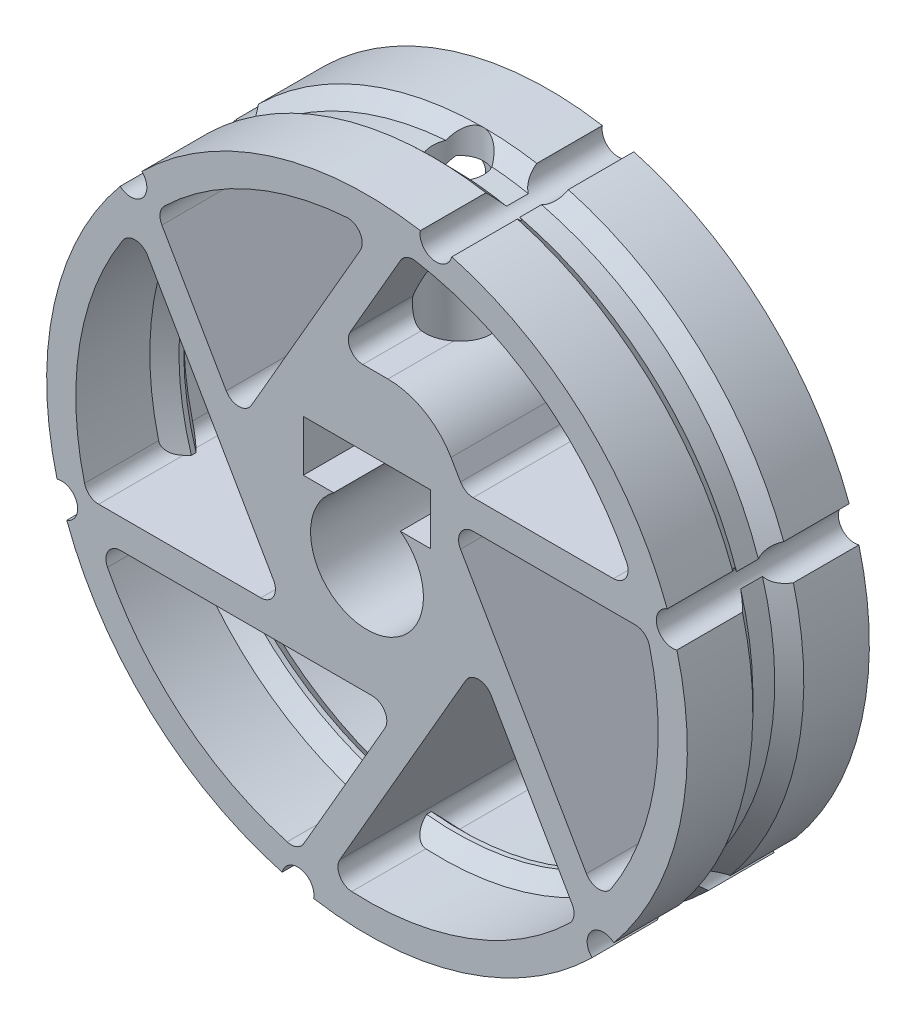
from build123d import *

# Parameters (mm, degrees)
SKETCH1_R               = 17.6
BOSS_EXTRUDE1_DEPTH     = 10
FILLET1_R               = 0.8
FILLET2_R               = 0.8
FILLET3_R               = 0.8
FILLET4_R               = 4
CUT_EXTRUDE1_REACH      = 32.564
CUT_EXTRUDE1_END_RADIUS = 16
SKETCH2_R               = 1.8
SKETCH6_R               = 1.4
CUT_EXTRUDE3_DEPTH      = 31.564194771
SKETCH3_R               = 0.886338762
CUT_EXTRUDE2_DEPTH      = 27.823870149


with BuildPart() as part:
    # Sketch1 → Boss-Extrude1 (new body)
    with BuildSketch(Plane.XY):
        Circle(SKETCH1_R)
        with BuildLine():
            Line((1.833030278, 2.5), (3.5, 2.5))
            Line((3.5, 2.5), (3.5, 5.3))
            Line((3.5, 5.3), (-3.5, 5.3))
            Line((-3.5, 5.3), (-3.5, 2.5))
            Line((-3.5, 2.5), (-1.833030278, 2.5))
            ThreePointArc((-1.833030278, 2.5), (0, -3.1), (1.833030278, 2.5))
        make_face(mode=Mode.SUBTRACT)
        with BuildLine():
            Line((-7.043673284, 0), (-12.678530784, 9.759859484))
            ThreePointArc((-12.678530784, 9.759859484), (-15.725575717, 2.95063864), (-15.354152533, -4.5))
            Line((-15.354152533, -4.5), (-4.445597073, -4.5))
            Line((-4.445597073, -4.5), (-7.043673284, 0))
        make_face(mode=Mode.SUBTRACT)
        with BuildLine():
            Line((-3.521836642, -6.1), (-14.791551643, -6.1))
            ThreePointArc((-14.791551643, -6.1), (-10.418115878, -12.14342874), (-3.779961949, -15.547086147))
            Line((-3.779961949, -15.547086147), (1.674315781, -6.1))
            Line((1.674315781, -6.1), (-3.521836642, -6.1))
        make_face(mode=Mode.SUBTRACT)
        with BuildLine():
            Line((3.521836642, -6.1), (-2.113020858, -15.859859484))
            ThreePointArc((-2.113020858, -15.859859484), (5.307459839, -15.09406738), (11.574190583, -11.047086147))
            Line((11.574190583, -11.047086147), (6.119912853, -1.6))
            Line((6.119912853, -1.6), (3.521836642, -6.1))
        make_face(mode=Mode.SUBTRACT)
        with BuildLine():
            Line((7.043673284, 0), (12.678530784, -9.759859484))
            ThreePointArc((12.678530784, -9.759859484), (15.725575717, -2.95063864), (15.354152533, 4.5))
            Line((15.354152533, 4.5), (4.445597073, 4.5))
            Line((4.445597073, 4.5), (7.043673284, 0))
        make_face(mode=Mode.SUBTRACT)
        with BuildLine():
            Line((-11.574190583, 11.047086147), (-7.043673284, 3.2))
            Line((-7.043673284, 3.2), (-3.46132901, 9.404802293))
            Line((-3.46132901, 9.404802293), (0.344271501, 15.996295732))
            ThreePointArc((0.344271501, 15.996295732), (-6.136076884, 14.776622093), (-11.574190583, 11.047086147))
        make_face(mode=Mode.SUBTRACT)
        with BuildLine():
            Line((3.46132901, 9.404802293), (5.369357503, 6.1))
            Line((5.369357503, 6.1), (14.791551643, 6.1))
            ThreePointArc((14.791551643, 6.1), (9.759859484, 12.678530784), (2.113020858, 15.859859484))
            Line((2.113020858, 15.859859484), (-1.613808149, 9.404802293))
            Line((-1.613808149, 9.404802293), (3.46132901, 9.404802293))
        make_face(mode=Mode.SUBTRACT)
    extrude(amount=BOSS_EXTRUDE1_DEPTH)

    # Fillet1
    fillet1_edges = [part.edges().sort_by_distance(p)[0] for p in [
        (4.445597073, 4.5, 5),
        (6.119912853, -1.6, 5),
        (1.674315781, -6.1, 5),
        (-4.445597073, -4.5, 5),
        (-7.043673284, 3.2, 5),
        (-1.613808149, 9.404802293, 5),
        (5.369357503, 6.1, 5),
    ]]
    fillet(fillet1_edges, radius=FILLET1_R)

    # Fillet2
    fillet2_edges = [part.edges().sort_by_distance(p)[0] for p in [
        (12.678530784, -9.759859484, 5),
        (14.791551643, 6.1, 5),
        (-12.678530784, 9.759859484, 5),
        (-14.791551643, -6.1, 5),
        (-2.113020858, -15.859859484, 5),
        (0.344271501, 15.996295732, 5),
    ]]
    fillet(fillet2_edges, radius=FILLET2_R)

    # Fillet3
    fillet3_edges = [part.edges().sort_by_distance(p)[0] for p in [
        (-15.354152533, -4.5, 5),
        (-11.574190583, 11.047086147, 5),
        (15.354152533, 4.5, 5),
        (11.574190583, -11.047086147, 5),
        (-3.779961949, -15.547086147, 5),
        (2.113020858, 15.859859484, 5),
    ]]
    fillet(fillet3_edges, radius=FILLET3_R)

    # Fillet4
    fillet4_edges = [part.edges().sort_by_distance(p)[0] for p in [
        (3.46132901, 9.404802293, 5),
    ]]
    fillet(fillet4_edges, radius=FILLET4_R)

    # Cut-Extrude1: up to this cylinder (the profile starts inside it)
    cut_extrude1_end = Plane(origin=(0, 0, 5), z_dir=(0, 0, -1)) * Cylinder(CUT_EXTRUDE1_END_RADIUS, 98.128, mode=Mode.PRIVATE)
    # Sketch2 → Cut-Extrude1 (cut, up to the surface)
    with BuildSketch(Plane.XZ.offset(-5.3), mode=Mode.PRIVATE) as cut_extrude1_sk1:
        with Locations((0, 5)):
            Circle(SKETCH2_R)
    cut_extrude1_tool1 = extrude(cut_extrude1_sk1.sketch, amount=-CUT_EXTRUDE1_REACH, mode=Mode.PRIVATE) & cut_extrude1_end
    add(cut_extrude1_tool1.solids().sort_by_distance((0, 5.3, 5))[0], mode=Mode.SUBTRACT)

    # Sketch7 → Revolve1 (revolve)
    with BuildSketch(Plane(origin=(0, 0, 0), x_dir=(1, 0, 0), z_dir=(0, 1, 0))):
        Polygon((-17.6, -2.46862915), (-17.6, -7.53137085), (-15.2, -5.13137085), (-15.2, -4.86862915), align=None)
    revolve(axis=Axis((0, 0, 10), (0, 0, -1)))

    # Sketch6 → Cut-Extrude3 (cut, through all)
    with BuildSketch(Plane.XZ.offset(-5.3)):
        with Locations((0, 5)):
            Circle(SKETCH6_R)
    extrude(amount=-CUT_EXTRUDE3_DEPTH, mode=Mode.SUBTRACT)

    # Sketch3 → Cut-Extrude2 (cut, through all)
    with BuildSketch(Plane.XY.offset(10)):
        with Locations((-3.80157893, -17.184527856)):
            Circle(SKETCH3_R)
        with Locations((-16.783027141, -5.3)):
            Circle(SKETCH3_R)
        with Locations((-12.98144821, 11.884527856)):
            Circle(SKETCH3_R)
        with Locations((3.80157893, 17.184527856)):
            Circle(SKETCH3_R)
        with Locations((16.783027141, 5.3)):
            Circle(SKETCH3_R)
        with Locations((12.98144821, -11.884527856)):
            Circle(SKETCH3_R)
    extrude(amount=-CUT_EXTRUDE2_DEPTH, mode=Mode.SUBTRACT)

    # Sketch5 → Cut-Revolve2 (revolve, cut)
    with BuildSketch(Plane(origin=(0, 0, 0), x_dir=(1, 0, 0), z_dir=(0, 1, 0))):
        Polygon((-17.6, -3.6), (-17.6, -6.4), (-16.8, -5.6), (-16.8, -4.4), align=None)
    revolve(axis=Axis((0, 0, 10), (0, 0, -1)), mode=Mode.SUBTRACT)


solid = part.part
